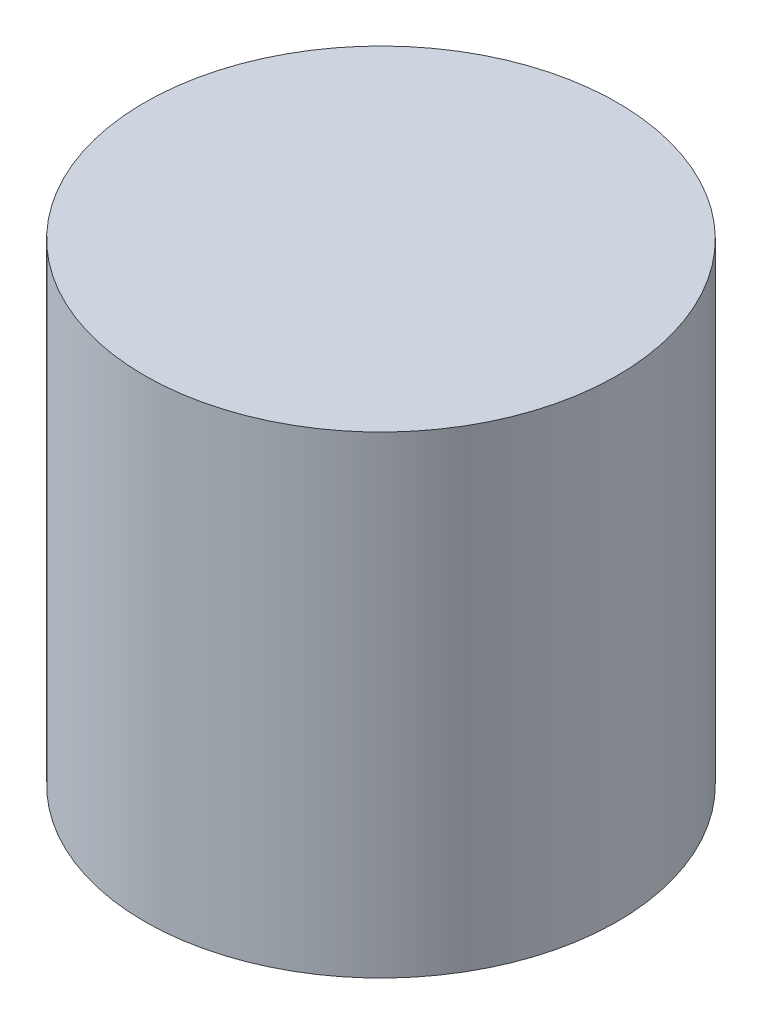
from build123d import *

# Parameters (mm, degrees)
SKETCH1_R           = 15.875
SKETCH1_R_2         = 12.7
BOSS_EXTRUDE1_DEPTH = 25.4
SKETCH4_R           = 15.875
BOSS_EXTRUDE2_DEPTH = 6.35


with BuildPart() as part:
    # Sketch1 → Boss-Extrude1 (new body)
    with BuildSketch(Plane(origin=(0, 0, 0), x_dir=(1, 0, 0), z_dir=(0, 1, 0))):
        Circle(SKETCH1_R)
        Circle(SKETCH1_R_2, mode=Mode.SUBTRACT)
    extrude(amount=BOSS_EXTRUDE1_DEPTH)

    # Sketch4 → Boss-Extrude2 (add)
    with BuildSketch(Plane(origin=(0, 25.4, 0), x_dir=(1, 0, 0), z_dir=(0, 1, 0))):
        Circle(SKETCH4_R)
    extrude(amount=BOSS_EXTRUDE2_DEPTH)


solid = part.part
